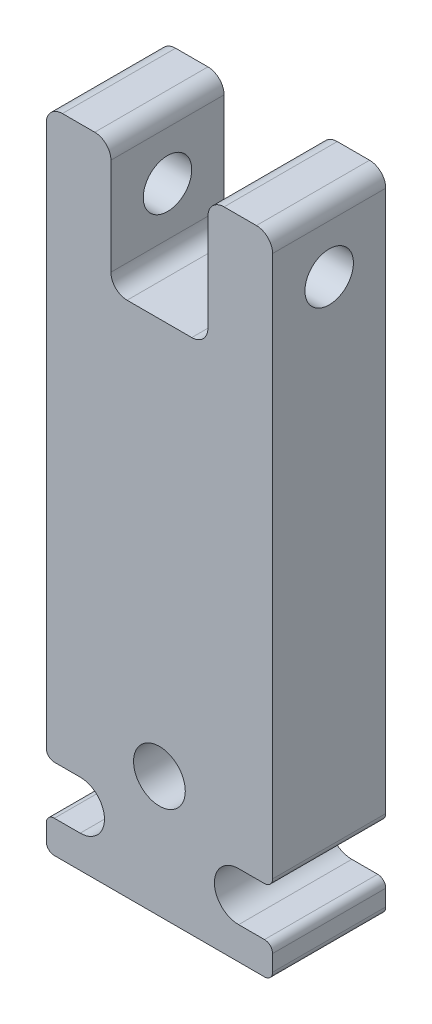
from build123d import *

# Parameters (mm, degrees)
CROQUIS1_R                 = 1.6
SALIENTE_EXTRUIR1_DEPTH    = 3.5
CORTAR_EXTRUIR1_DEPTH      = 22.476731595
CORTAR_EXTRUIR1_DEPTH_BACK = 22.476731595
CROQUIS2_R                 = 1.5
REDONDEO1_R                = 1
REDONDEO2_R                = 0.5


with BuildPart() as part:
    # Croquis1 → Saliente-Extruir1 (new, symmetric)
    with BuildSketch(Plane.XY):
        with BuildLine():
            Line((3, 20), (7, 20))
            Line((7, 20), (7, -15))
            Line((7, -15), (4.9, -15))
            ThreePointArc((4.9, -15), (3.4, -16.5), (4.9, -18))
            Line((4.9, -18), (7, -18))
            Line((7, -18), (7, -20))
            Line((7, -20), (-7, -20))
            Line((-7, -20), (-7, -18))
            Line((-7, -18), (-4.9, -18))
            ThreePointArc((-4.9, -18), (-3.4, -16.5), (-4.9, -15))
            Line((-4.9, -15), (-7, -15))
            Line((-7, -15), (-7, 20))
            Line((-7, 20), (-3, 20))
            Line((-3, 20), (-3, 12))
            Line((-3, 12), (3, 12))
            Line((3, 12), (3, 20))
        make_face()
        with Locations((0, -12.5)):
            Circle(CROQUIS1_R, mode=Mode.SUBTRACT)
    extrude(amount=SALIENTE_EXTRUIR1_DEPTH, both=True)

    # Croquis2 → Cortar-Extruir1 (cut, two sides: drawn at the far end of the back side and taken through both)
    with BuildSketch(Plane(origin=(0, 0, 0), x_dir=(0, 0, -1), z_dir=(1, 0, 0)).offset(-CORTAR_EXTRUIR1_DEPTH_BACK)):
        with Locations((0, 16)):
            Circle(CROQUIS2_R)
    extrude(amount=CORTAR_EXTRUIR1_DEPTH + CORTAR_EXTRUIR1_DEPTH_BACK, mode=Mode.SUBTRACT)

    # Redondeo1
    redondeo1_edges = [part.edges().sort_by_distance(p)[0] for p in [
        (-7, 20, 0),
        (-3, 20, 0),
        (-3, 12, 0),
        (3, 12, 0),
        (3, 20, 0),
        (7, 20, 0),
    ]]
    fillet(redondeo1_edges, radius=REDONDEO1_R)

    # Redondeo2
    redondeo2_edges = [part.edges().sort_by_distance(p)[0] for p in [
        (7, -20, 0),
        (-7, -20, 0),
        (7, -18, 0),
        (7, -15, 0),
        (-7, -18, 0),
        (-7, -15, 0),
    ]]
    fillet(redondeo2_edges, radius=REDONDEO2_R)


solid = part.part
